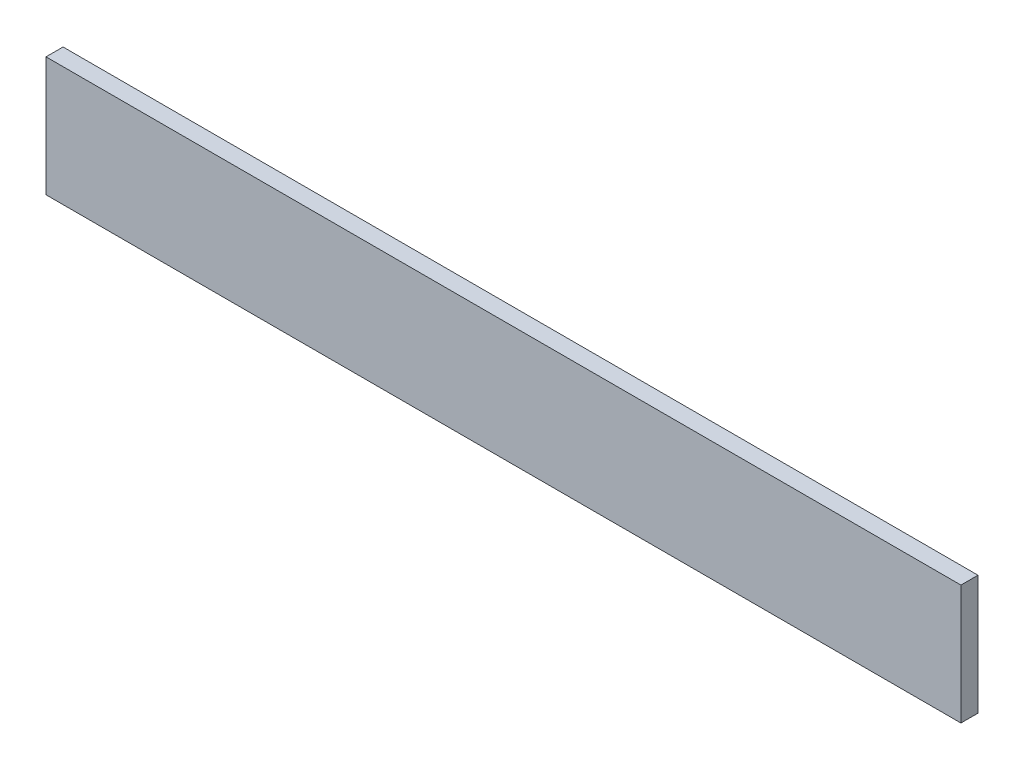
from build123d import *

# Parameters (mm, degrees)
SKETCH_1_W             = 536
SKETCH_1_H             = 70
SM_BASE_FLANGE_1_DEPTH = 10


# Sheet-metal steps are written as plain solids
with BuildPart() as part:
    # Sketch 1 → 基体-法兰1 (new body)
    with BuildSketch(Plane.XY):
        Rectangle(SKETCH_1_W, SKETCH_1_H)
    extrude(amount=-SM_BASE_FLANGE_1_DEPTH)


solid = part.part
